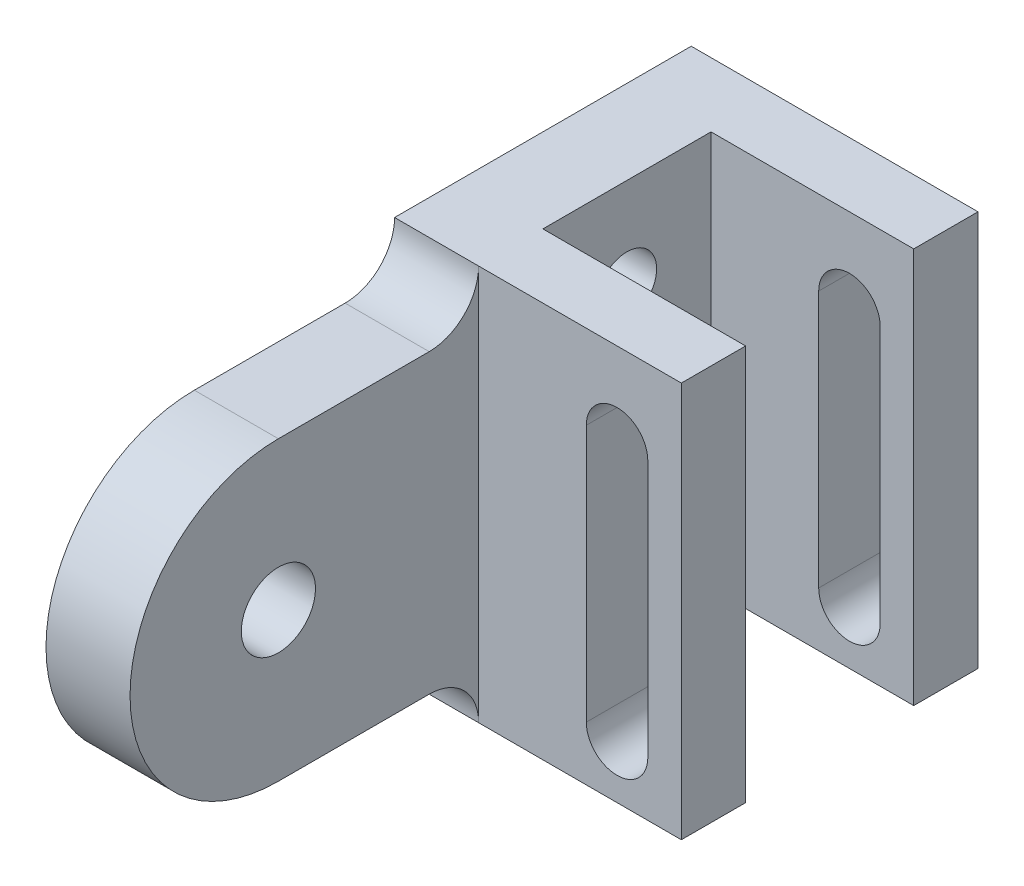
from build123d import *

# Parameters (mm, degrees)
BOSS_EXTRUDE1_DEPTH = 80
CUT_EXTRUDE1_DEPTH  = 80
SKETCH4_R           = 6
CUT_EXTRUDE4_DEPTH  = 80
BOSS_EXTRUDE2_DEPTH = 17
SKETCH9_R           = 7.5
CUT_EXTRUDE5_DEPTH  = 17
FILLET2_R           = 10
FILLET3_R           = 10


with BuildPart() as part:
    # Sketch1 → Boss-Extrude1 (new body)
    with BuildSketch(Plane(origin=(0, 0, 0), x_dir=(1, 0, 0), z_dir=(0, 1, 0))):
        Polygon((0, 0), (58, 0), (58, 13), (17, 13), (17, 47), (58, 47), (58, 60), (0, 60), align=None)
    extrude(amount=BOSS_EXTRUDE1_DEPTH)

    # Sketch2 → Cut-Extrude1 (cut)
    with BuildSketch(Plane.XY):
        with BuildLine():
            Line((38.781649875, 11), (38.781649875, 63))
            ThreePointArc((38.781649875, 63), (45, 69.218350125), (51.218350125, 63))
            Line((51.218350125, 63), (51.218350125, 11))
            ThreePointArc((51.218350125, 11), (45, 4.781649875), (38.781649875, 11))
        make_face()
    extrude(amount=-CUT_EXTRUDE1_DEPTH, mode=Mode.SUBTRACT)

    # Sketch4 → Cut-Extrude4 (cut)
    with BuildSketch(Plane(origin=(17, 0, 0), x_dir=(0, 0, -1), z_dir=(1, 0, 0))):
        with Locations((30, 18.5)):
            Circle(SKETCH4_R)
        with Locations((30, 61.5)):
            Circle(SKETCH4_R)
    extrude(amount=-CUT_EXTRUDE4_DEPTH, mode=Mode.SUBTRACT)

    # Sketch8 → Boss-Extrude2 (add)
    with BuildSketch(Plane.ZY):
        with BuildLine():
            Line((40.5, 70), (0, 70))
            Line((0, 70), (0, 10))
            Line((0, 10), (40.5, 10))
            ThreePointArc((40.5, 10), (70.5, 40), (40.5, 70))
        make_face()
    extrude(amount=-BOSS_EXTRUDE2_DEPTH)

    # Sketch9 → Cut-Extrude5 (cut)
    with BuildSketch(Plane.ZY):
        with Locations((40.5, 40)):
            Circle(SKETCH9_R)
    extrude(amount=-CUT_EXTRUDE5_DEPTH, mode=Mode.SUBTRACT)

    # Fillet2
    fillet2_edges = [part.edges().sort_by_distance(p)[0] for p in [
        (8.5, 70, 0),
    ]]
    fillet(fillet2_edges, radius=FILLET2_R - 0.0001)  # a hair under: the kernel refuses the full size

    # Fillet3
    fillet3_edges = [part.edges().sort_by_distance(p)[0] for p in [
        (8.5, 10, 0),
    ]]
    fillet(fillet3_edges, radius=FILLET3_R - 0.0001)  # a hair under: the kernel refuses the full size


solid = part.part
